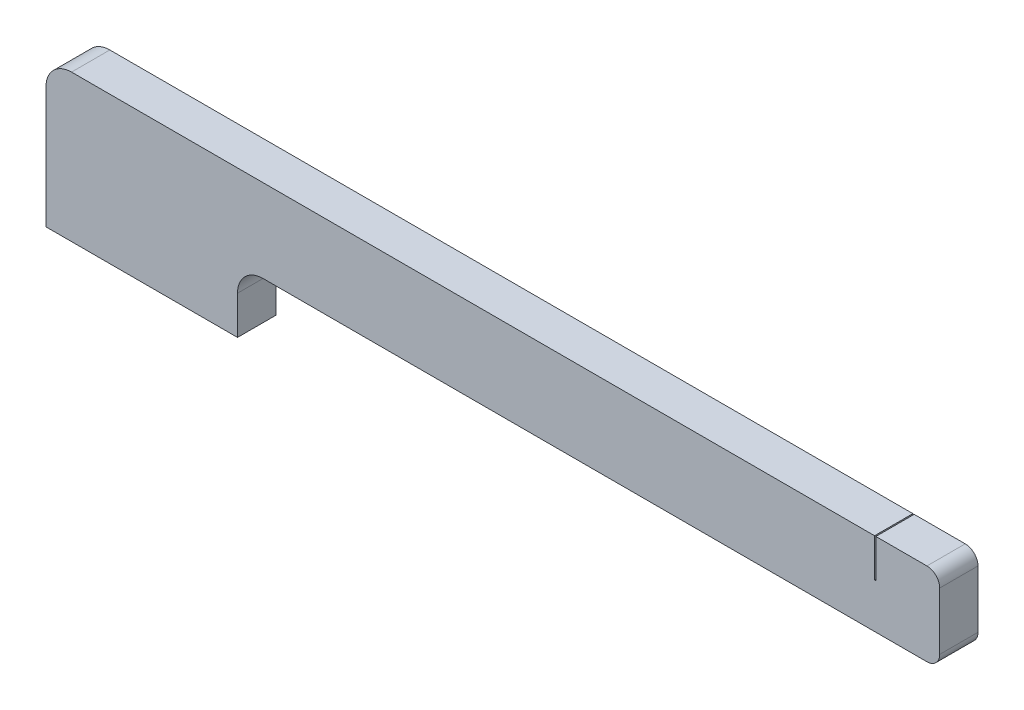
from build123d import *

# Parameters (mm, degrees)
BOSS_EXTRUDE1_DEPTH = 3
SKETCH3_W           = 0.1
SKETCH3_H           = 3
CUT_EXTRUDE1_DEPTH  = 3


with BuildPart() as part:
    # Sketch1 → Boss-Extrude1 (new body)
    with BuildSketch(Plane.XY):
        with BuildLine():
            Line((0, 0), (0, 9.5))
            ThreePointArc((0, 9.5), (0.585786438, 10.914213562), (2, 11.5))
            Line((2, 11.5), (69, 11.5))
            ThreePointArc((69, 11.5), (69.707106781, 11.207106781), (70, 10.5))
            Line((70, 10.5), (70, 6))
            ThreePointArc((70, 6), (69.707106781, 5.292893219), (69, 5))
            Line((69, 5), (17, 5))
            ThreePointArc((17, 5), (15.585786438, 4.414213562), (15, 3))
            Line((15, 3), (15, 0))
            Line((15, 0), (0, 0))
        make_face()
    extrude(amount=BOSS_EXTRUDE1_DEPTH)

    # Sketch3 → Cut-Extrude1 (cut)
    with BuildSketch(Plane(origin=(0, 11.5, 0), x_dir=(1, 0, 0), z_dir=(0, 1, 0))):
        with Locations((64.95, -1.5)):
            Rectangle(SKETCH3_W, SKETCH3_H)
    extrude(amount=-CUT_EXTRUDE1_DEPTH, mode=Mode.SUBTRACT)


solid = part.part
